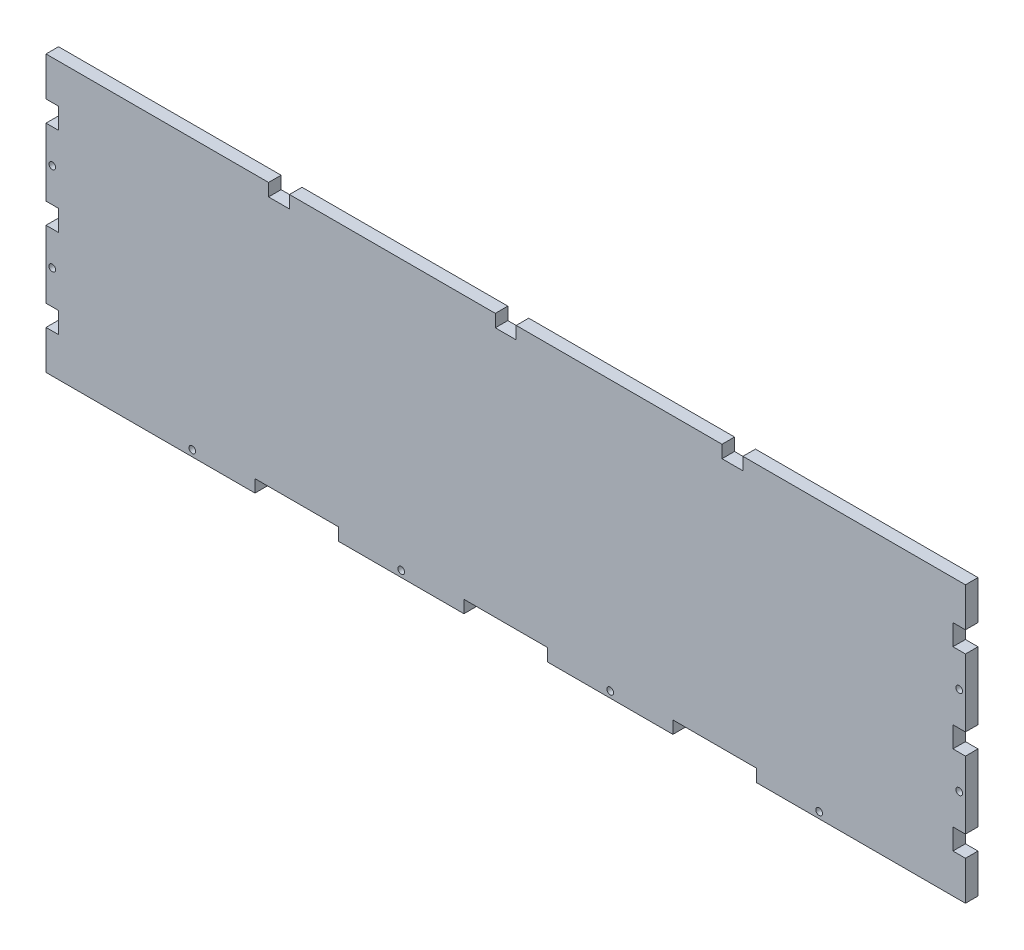
from build123d import *

# Parameters (mm, degrees)
SKETCH1_W           = 440
SKETCH1_H           = 132
BOSS_EXTRUDE1_DEPTH = 6
CUT_EXTRUDE1_REACH  = 231.765
SKETCH2_R           = 1.6
SKETCH2_W           = 6
SKETCH2_H           = 10
CUT_EXTRUDE2_REACH  = 231.765
SKETCH3_R           = 1.6
CUT_EXTRUDE3_REACH  = 231.765
SKETCH4_W           = 40
SKETCH4_H           = 6
SKETCH5_W           = 10
SKETCH5_H           = 6
CUT_EXTRUDE4_DEPTH  = 6


with BuildPart() as part:
    # Sketch1 → Boss-Extrude1 (new body)
    with BuildSketch(Plane.XY):
        Rectangle(SKETCH1_W, SKETCH1_H)
    extrude(amount=BOSS_EXTRUDE1_DEPTH)

    # Sketch2 → Cut-Extrude1 (cut, up to next)
    with BuildSketch(Plane(origin=(0, 0, 0), x_dir=(-1, 0, 0), z_dir=(0, 0, -1)), mode=Mode.PRIVATE) as cut_extrude1_sk1:
        with Locations((217, 21.166064391)):
            Circle(SKETCH2_R)
    cut_extrude1_tool1 = extrude(cut_extrude1_sk1.sketch, amount=-CUT_EXTRUDE1_REACH, mode=Mode.PRIVATE) & part.part
    # Sketch2 → Cut-Extrude1 (cut, up to next)
    with BuildSketch(Plane(origin=(0, 0, 0), x_dir=(-1, 0, 0), z_dir=(0, 0, -1)), mode=Mode.PRIVATE) as cut_extrude1_sk2:
        with Locations((217, -21.166064391)):
            Circle(SKETCH2_R)
    cut_extrude1_tool2 = extrude(cut_extrude1_sk2.sketch, amount=-CUT_EXTRUDE1_REACH, mode=Mode.PRIVATE) & part.part
    # Sketch2 → Cut-Extrude1 (cut, up to next)
    with BuildSketch(Plane(origin=(0, 0, 0), x_dir=(-1, 0, 0), z_dir=(0, 0, -1)), mode=Mode.PRIVATE) as cut_extrude1_sk3:
        with Locations((-217, 21.166064391)):
            Circle(SKETCH2_R)
    cut_extrude1_tool3 = extrude(cut_extrude1_sk3.sketch, amount=-CUT_EXTRUDE1_REACH, mode=Mode.PRIVATE) & part.part
    # Sketch2 → Cut-Extrude1 (cut, up to next)
    with BuildSketch(Plane(origin=(0, 0, 0), x_dir=(-1, 0, 0), z_dir=(0, 0, -1)), mode=Mode.PRIVATE) as cut_extrude1_sk4:
        with Locations((-217, -21.166064391)):
            Circle(SKETCH2_R)
    cut_extrude1_tool4 = extrude(cut_extrude1_sk4.sketch, amount=-CUT_EXTRUDE1_REACH, mode=Mode.PRIVATE) & part.part
    # Sketch2 → Cut-Extrude1 (cut, up to next)
    with BuildSketch(Plane(origin=(0, 0, 0), x_dir=(-1, 0, 0), z_dir=(0, 0, -1)), mode=Mode.PRIVATE) as cut_extrude1_sk5:
        with Locations((217, 42.332128782)):
            Rectangle(SKETCH2_W, SKETCH2_H)
    cut_extrude1_tool5 = extrude(cut_extrude1_sk5.sketch, amount=-CUT_EXTRUDE1_REACH, mode=Mode.PRIVATE) & part.part
    # Sketch2 → Cut-Extrude1 (cut, up to next)
    with BuildSketch(Plane(origin=(0, 0, 0), x_dir=(-1, 0, 0), z_dir=(0, 0, -1)), mode=Mode.PRIVATE) as cut_extrude1_sk6:
        with Locations((217, -42.332128782)):
            Rectangle(SKETCH2_W, SKETCH2_H)
    cut_extrude1_tool6 = extrude(cut_extrude1_sk6.sketch, amount=-CUT_EXTRUDE1_REACH, mode=Mode.PRIVATE) & part.part
    # Sketch2 → Cut-Extrude1 (cut, up to next)
    with BuildSketch(Plane(origin=(0, 0, 0), x_dir=(-1, 0, 0), z_dir=(0, 0, -1)), mode=Mode.PRIVATE) as cut_extrude1_sk7:
        with Locations((-217, -42.332128782)):
            Rectangle(SKETCH2_W, SKETCH2_H)
    cut_extrude1_tool7 = extrude(cut_extrude1_sk7.sketch, amount=-CUT_EXTRUDE1_REACH, mode=Mode.PRIVATE) & part.part
    # Sketch2 → Cut-Extrude1 (cut, up to next)
    with BuildSketch(Plane(origin=(0, 0, 0), x_dir=(-1, 0, 0), z_dir=(0, 0, -1)), mode=Mode.PRIVATE) as cut_extrude1_sk8:
        with Locations((-217, 42.332128782)):
            Rectangle(SKETCH2_W, SKETCH2_H)
    cut_extrude1_tool8 = extrude(cut_extrude1_sk8.sketch, amount=-CUT_EXTRUDE1_REACH, mode=Mode.PRIVATE) & part.part
    # Sketch2 → Cut-Extrude1 (cut, up to next)
    with BuildSketch(Plane(origin=(0, 0, 0), x_dir=(-1, 0, 0), z_dir=(0, 0, -1)), mode=Mode.PRIVATE) as cut_extrude1_sk9:
        with Locations((217, 0)):
            Rectangle(SKETCH2_W, SKETCH2_H)
    cut_extrude1_tool9 = extrude(cut_extrude1_sk9.sketch, amount=-CUT_EXTRUDE1_REACH, mode=Mode.PRIVATE) & part.part
    # Sketch2 → Cut-Extrude1 (cut, up to next)
    with BuildSketch(Plane(origin=(0, 0, 0), x_dir=(-1, 0, 0), z_dir=(0, 0, -1)), mode=Mode.PRIVATE) as cut_extrude1_sk10:
        with Locations((-217, 0)):
            Rectangle(SKETCH2_W, SKETCH2_H)
    cut_extrude1_tool10 = extrude(cut_extrude1_sk10.sketch, amount=-CUT_EXTRUDE1_REACH, mode=Mode.PRIVATE) & part.part
    add(cut_extrude1_tool1.solids().sort_by_distance((-217, 21.166064, 0))[0], mode=Mode.SUBTRACT)
    add(cut_extrude1_tool2.solids().sort_by_distance((-217, -21.166064, 0))[0], mode=Mode.SUBTRACT)
    add(cut_extrude1_tool3.solids().sort_by_distance((217, 21.166064, 0))[0], mode=Mode.SUBTRACT)
    add(cut_extrude1_tool4.solids().sort_by_distance((217, -21.166064, 0))[0], mode=Mode.SUBTRACT)
    add(cut_extrude1_tool5.solids().sort_by_distance((-217, 42.332129, 0))[0], mode=Mode.SUBTRACT)
    add(cut_extrude1_tool6.solids().sort_by_distance((-217, -42.332129, 0))[0], mode=Mode.SUBTRACT)
    add(cut_extrude1_tool7.solids().sort_by_distance((217, -42.332129, 0))[0], mode=Mode.SUBTRACT)
    add(cut_extrude1_tool8.solids().sort_by_distance((217, 42.332129, 0))[0], mode=Mode.SUBTRACT)
    add(cut_extrude1_tool9.solids().sort_by_distance((-217, 0, 0))[0], mode=Mode.SUBTRACT)
    add(cut_extrude1_tool10.solids().sort_by_distance((217, 0, 0))[0], mode=Mode.SUBTRACT)

    # Sketch3 → Cut-Extrude2 (cut, up to next)
    with BuildSketch(Plane(origin=(0, 0, 0), x_dir=(-1, 0, 0), z_dir=(0, 0, -1)), mode=Mode.PRIVATE) as cut_extrude2_sk1:
        with Locations((-150, -63)):
            Circle(SKETCH3_R)
    cut_extrude2_tool1 = extrude(cut_extrude2_sk1.sketch, amount=-CUT_EXTRUDE2_REACH, mode=Mode.PRIVATE) & part.part
    # Sketch3 → Cut-Extrude2 (cut, up to next)
    with BuildSketch(Plane(origin=(0, 0, 0), x_dir=(-1, 0, 0), z_dir=(0, 0, -1)), mode=Mode.PRIVATE) as cut_extrude2_sk2:
        with Locations((-50, -63)):
            Circle(SKETCH3_R)
    cut_extrude2_tool2 = extrude(cut_extrude2_sk2.sketch, amount=-CUT_EXTRUDE2_REACH, mode=Mode.PRIVATE) & part.part
    # Sketch3 → Cut-Extrude2 (cut, up to next)
    with BuildSketch(Plane(origin=(0, 0, 0), x_dir=(-1, 0, 0), z_dir=(0, 0, -1)), mode=Mode.PRIVATE) as cut_extrude2_sk3:
        with Locations((50, -63)):
            Circle(SKETCH3_R)
    cut_extrude2_tool3 = extrude(cut_extrude2_sk3.sketch, amount=-CUT_EXTRUDE2_REACH, mode=Mode.PRIVATE) & part.part
    # Sketch3 → Cut-Extrude2 (cut, up to next)
    with BuildSketch(Plane(origin=(0, 0, 0), x_dir=(-1, 0, 0), z_dir=(0, 0, -1)), mode=Mode.PRIVATE) as cut_extrude2_sk4:
        with Locations((150, -63)):
            Circle(SKETCH3_R)
    cut_extrude2_tool4 = extrude(cut_extrude2_sk4.sketch, amount=-CUT_EXTRUDE2_REACH, mode=Mode.PRIVATE) & part.part
    add(cut_extrude2_tool1.solids().sort_by_distance((150, -63, 0))[0], mode=Mode.SUBTRACT)
    add(cut_extrude2_tool2.solids().sort_by_distance((50, -63, 0))[0], mode=Mode.SUBTRACT)
    add(cut_extrude2_tool3.solids().sort_by_distance((-50, -63, 0))[0], mode=Mode.SUBTRACT)
    add(cut_extrude2_tool4.solids().sort_by_distance((-150, -63, 0))[0], mode=Mode.SUBTRACT)

    # Sketch4 → Cut-Extrude3 (cut, up to next)
    with BuildSketch(Plane(origin=(0, 0, 0), x_dir=(-1, 0, 0), z_dir=(0, 0, -1)), mode=Mode.PRIVATE) as cut_extrude3_sk1:
        with Locations((100, -63)):
            Rectangle(SKETCH4_W, SKETCH4_H)
    cut_extrude3_tool1 = extrude(cut_extrude3_sk1.sketch, amount=-CUT_EXTRUDE3_REACH, mode=Mode.PRIVATE) & part.part
    # Sketch4 → Cut-Extrude3 (cut, up to next)
    with BuildSketch(Plane(origin=(0, 0, 0), x_dir=(-1, 0, 0), z_dir=(0, 0, -1)), mode=Mode.PRIVATE) as cut_extrude3_sk2:
        with Locations((0, -63)):
            Rectangle(SKETCH4_W, SKETCH4_H)
    cut_extrude3_tool2 = extrude(cut_extrude3_sk2.sketch, amount=-CUT_EXTRUDE3_REACH, mode=Mode.PRIVATE) & part.part
    # Sketch4 → Cut-Extrude3 (cut, up to next)
    with BuildSketch(Plane(origin=(0, 0, 0), x_dir=(-1, 0, 0), z_dir=(0, 0, -1)), mode=Mode.PRIVATE) as cut_extrude3_sk3:
        with Locations((-100, -63)):
            Rectangle(SKETCH4_W, SKETCH4_H)
    cut_extrude3_tool3 = extrude(cut_extrude3_sk3.sketch, amount=-CUT_EXTRUDE3_REACH, mode=Mode.PRIVATE) & part.part
    add(cut_extrude3_tool1.solids().sort_by_distance((-100, -63, 0))[0], mode=Mode.SUBTRACT)
    add(cut_extrude3_tool2.solids().sort_by_distance((0, -63, 0))[0], mode=Mode.SUBTRACT)
    add(cut_extrude3_tool3.solids().sort_by_distance((100, -63, 0))[0], mode=Mode.SUBTRACT)

    # Sketch5 → Cut-Extrude4 (cut)
    with BuildSketch(Plane(origin=(0, 66, 0), x_dir=(1, 0, 0), z_dir=(0, 1, 0))):
        with Locations((-108.5, -3)):
            Rectangle(SKETCH5_W, SKETCH5_H)
        with Locations((0, -3)):
            Rectangle(SKETCH5_W, SKETCH5_H)
        with Locations((108.5, -3)):
            Rectangle(SKETCH5_W, SKETCH5_H)
    extrude(amount=-CUT_EXTRUDE4_DEPTH, mode=Mode.SUBTRACT)


solid = part.part
